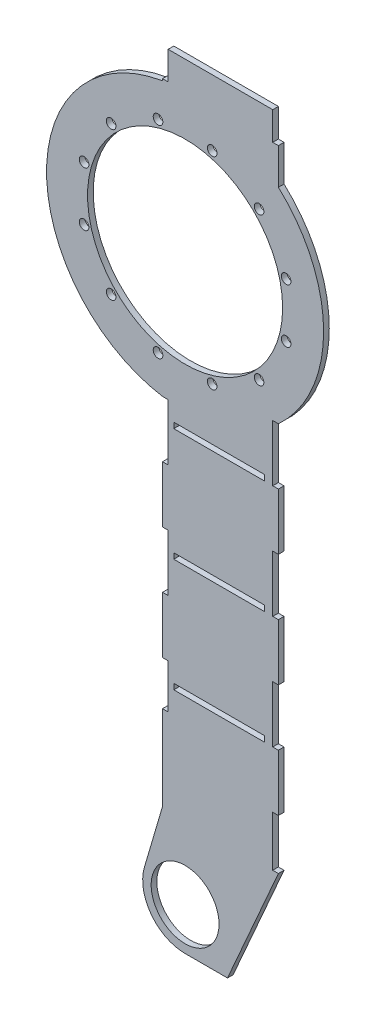
from build123d import *

# Parameters (mm, degrees)
SKETCH_1_R      = 12
SKETCH_1_W      = 32
SKETCH_1_H      = 2
SKETCH_1_R_2    = 1.7
SKETCH_1_R_3    = 34.5
EXTRUDE_1_DEPTH = 2


with BuildPart() as part:
    # 草图1 → 凸台-拉伸1 (new body)
    with BuildSketch(Plane.XY):
        with BuildLine():
            ThreePointArc((-8, 48.342527861), (-49, 0), (-8, -48.342527861))
            Line((-8, -48.342527861), (-6, -48.342527861))
            Line((-6, -48.342527861), (-6, -68.342527861))
            Line((-6, -68.342527861), (-8, -68.342527861))
            Line((-8, -68.342527861), (-8, -88.342527861))
            Line((-8, -88.342527861), (-6, -88.342527861))
            Line((-6, -88.342527861), (-6, -108.342527861))
            Line((-6, -108.342527861), (-8, -108.342527861))
            Line((-8, -108.342527861), (-8, -128.342527861))
            Line((-8, -128.342527861), (-6, -128.342527861))
            Line((-6, -128.342527861), (-6, -144.000000011))
            Line((-6, -144.000000011), (-8, -144.000000011))
            Line((-8, -144.000000011), (-8, -174))
            Line((-8, -174), (-14.392579, -195.774639692))
            ThreePointArc((-14.392579, -195.774639692), (-12.007922481, -208.989426995), (0, -215))
            Line((0, -215), (15, -215))
            Line((15, -215), (33, -174))
            Line((33, -174), (31, -174))
            Line((31, -174), (31, -156.221540553))
            Line((31, -156.221540553), (33, -156.221540553))
            Line((33, -156.221540553), (33, -136.221540553))
            Line((33, -136.221540553), (31, -136.221540553))
            Line((31, -136.221540553), (31, -116.221540553))
            Line((31, -116.221540553), (33, -116.221540553))
            Line((33, -116.221540553), (33, -96.221540553))
            Line((33, -96.221540553), (31, -96.221540553))
            Line((31, -96.221540553), (31, -76.221540553))
            Line((31, -76.221540553), (33, -76.221540553))
            Line((33, -76.221540553), (33, -56.221540553))
            Line((33, -56.221540553), (31, -56.221540553))
            Line((31, -56.221540553), (31, -36.221540553))
            Line((31, -36.221540553), (33, -36.221540553))
            ThreePointArc((33, -36.221540553), (49, 0), (33, 36.221540553))
            Line((33, 36.221540553), (33, 49))
            Line((33, 49), (31, 49))
            Line((31, 49), (31, 59))
            Line((31, 59), (-6, 59))
            Line((-6, 59), (-6, 49))
            Line((-6, 49), (-8, 49))
            Line((-8, 49), (-8, 48.342527861))
        make_face()
        with Locations((0, -200)):
            Circle(SKETCH_1_R, mode=Mode.SUBTRACT)
        with Locations((12, -135.221540553)):
            Rectangle(SKETCH_1_W, SKETCH_1_H, mode=Mode.SUBTRACT)
        with Locations((12, -95.221540553)):
            Rectangle(SKETCH_1_W, SKETCH_1_H, mode=Mode.SUBTRACT)
        with Locations((-35.739255573, -9.576304669)):
            Circle(SKETCH_1_R_2, mode=Mode.SUBTRACT)
        with Locations((-26.162950904, -26.162950904)):
            Circle(SKETCH_1_R_2, mode=Mode.SUBTRACT)
        with Locations((-9.576304669, -35.739255573)):
            Circle(SKETCH_1_R_2, mode=Mode.SUBTRACT)
        with Locations((-35.739255573, 9.576304669)):
            Circle(SKETCH_1_R_2, mode=Mode.SUBTRACT)
        with Locations((-26.162950904, 26.162950904)):
            Circle(SKETCH_1_R_2, mode=Mode.SUBTRACT)
        Circle(SKETCH_1_R_3, mode=Mode.SUBTRACT)
        with Locations((-9.576304669, 35.739255573)):
            Circle(SKETCH_1_R_2, mode=Mode.SUBTRACT)
        with Locations((12, -55.221540553)):
            Rectangle(SKETCH_1_W, SKETCH_1_H, mode=Mode.SUBTRACT)
        with Locations((9.576304669, -35.739255573)):
            Circle(SKETCH_1_R_2, mode=Mode.SUBTRACT)
        with Locations((26.162950904, -26.162950904)):
            Circle(SKETCH_1_R_2, mode=Mode.SUBTRACT)
        with Locations((35.739255573, -9.576304669)):
            Circle(SKETCH_1_R_2, mode=Mode.SUBTRACT)
        with Locations((9.576304669, 35.739255573)):
            Circle(SKETCH_1_R_2, mode=Mode.SUBTRACT)
        with Locations((35.739255573, 9.576304669)):
            Circle(SKETCH_1_R_2, mode=Mode.SUBTRACT)
        with Locations((26.162950904, 26.162950904)):
            Circle(SKETCH_1_R_2, mode=Mode.SUBTRACT)
    extrude(amount=EXTRUDE_1_DEPTH)


solid = part.part
